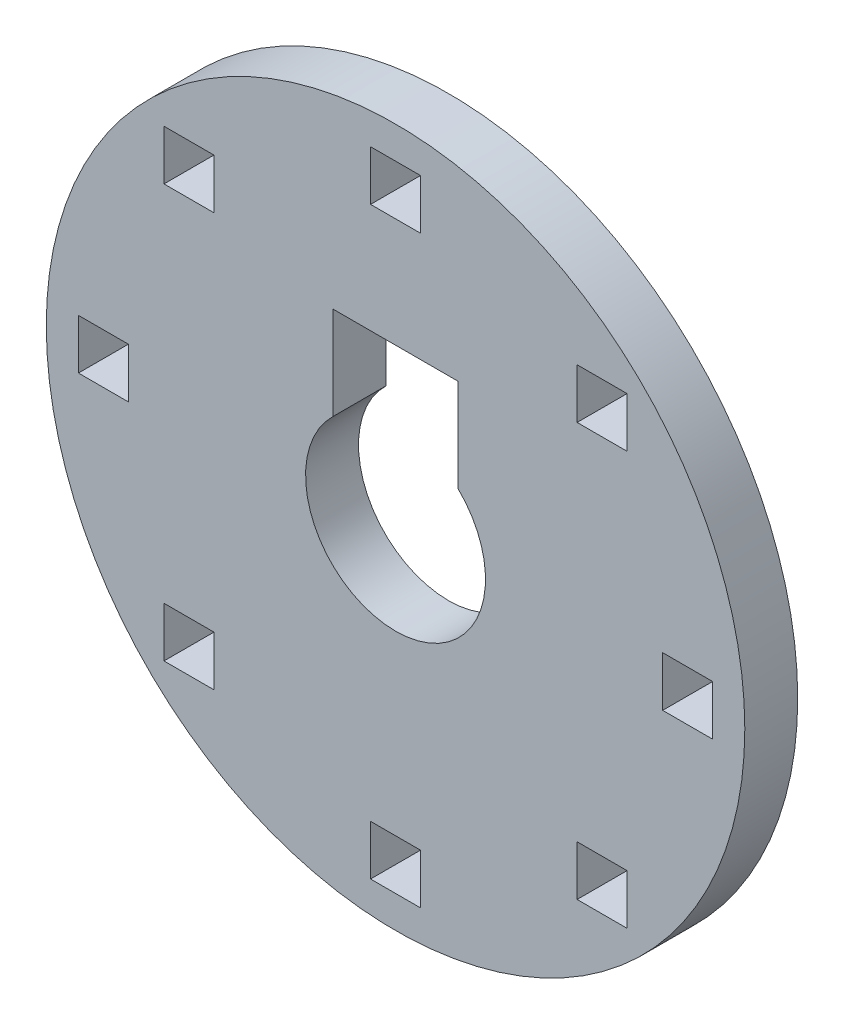
from build123d import *

# Parameters (mm, degrees)
SKETCH1_R           = 20.955
SKETCH1_W           = 2.9972
SKETCH1_H           = 2.9972
BOSS_EXTRUDE1_DEPTH = 3.175
CUT_EXTRUDE1_DEPTH  = 3.175


# Read off the part's stored shape, not the designer's step: Cut-Extrude1
with BuildPart() as part:
    # Sketch1 → Boss-Extrude1 (new body)
    with BuildSketch(Plane.XY):
        Circle(SKETCH1_R)
        with Locations((0, 17.526)):
            Rectangle(SKETCH1_W, SKETCH1_H, mode=Mode.SUBTRACT)
        with Locations((0, -17.526)):
            Rectangle(SKETCH1_W, SKETCH1_H, mode=Mode.SUBTRACT)
        with Locations((17.526, 0)):
            Rectangle(SKETCH1_W, SKETCH1_H, mode=Mode.SUBTRACT)
        with Locations((-17.526, 0)):
            Rectangle(SKETCH1_W, SKETCH1_H, mode=Mode.SUBTRACT)
        with Locations((12.392753447, 12.392753447)):
            Rectangle(SKETCH1_W, SKETCH1_H, mode=Mode.SUBTRACT)
        with Locations((-12.392753447, 12.392753447)):
            Rectangle(SKETCH1_W, SKETCH1_H, mode=Mode.SUBTRACT)
        with Locations((-12.392753447, -12.392753447)):
            Rectangle(SKETCH1_W, SKETCH1_H, mode=Mode.SUBTRACT)
        with Locations((12.392753447, -12.392753447)):
            Rectangle(SKETCH1_W, SKETCH1_H, mode=Mode.SUBTRACT)
    extrude(amount=BOSS_EXTRUDE1_DEPTH)

    # Cut-Extrude1 outline → Cut-Extrude1 (cut)
    with BuildSketch(Plane.XY):
        with BuildLine():
            Line((-3.7465, 9.4615), (-3.7465, 3.885452869))
            ThreePointArc((-3.7465, 3.885452869), (0, -5.3975), (3.7465, 3.885452869))
            Line((3.7465, 3.885452869), (3.7465, 9.4615))
            Line((3.7465, 9.4615), (-3.7465, 9.4615))
        make_face()
    extrude(amount=CUT_EXTRUDE1_DEPTH, mode=Mode.SUBTRACT)


solid = part.part
